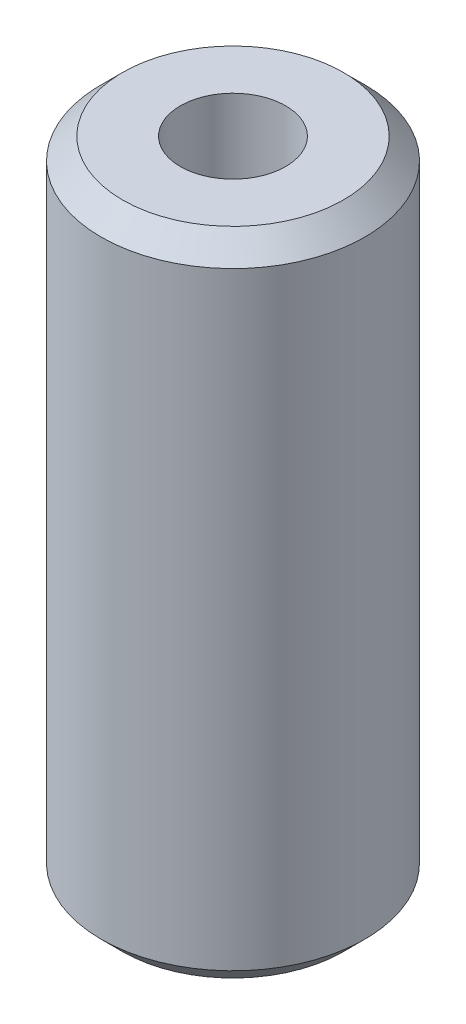
from build123d import *

# Parameters (mm, degrees)
SKETCH1_R           = 27.5
BOSS_EXTRUDE1_DEPTH = 135.732648483
SKETCH2_R           = 10.980823746
CUT_EXTRUDE1_DEPTH  = 142.194376178
CHAMFER1_SIZE       = 4.467275637


with BuildPart() as part:
    # Sketch1 → Boss-Extrude1 (new body)
    with BuildSketch(Plane(origin=(0, 0, 0), x_dir=(1, 0, 0), z_dir=(0, 1, 0))):
        Circle(SKETCH1_R)
    extrude(amount=BOSS_EXTRUDE1_DEPTH)

    # Sketch2 → Cut-Extrude1 (cut, through all)
    with BuildSketch(Plane(origin=(0, 0, 0), x_dir=(1, 0, 0), z_dir=(0, 1, 0))):
        Circle(SKETCH2_R)
    extrude(amount=CUT_EXTRUDE1_DEPTH, mode=Mode.SUBTRACT)

    # Chamfer1
    chamfer1_edges = [part.edges().sort_by_distance(p)[0] for p in [
        (-27.5, 135.732648483, 0),
        (-27.5, 0, 0),
    ]]
    chamfer(chamfer1_edges, length=CHAMFER1_SIZE)


solid = part.part
